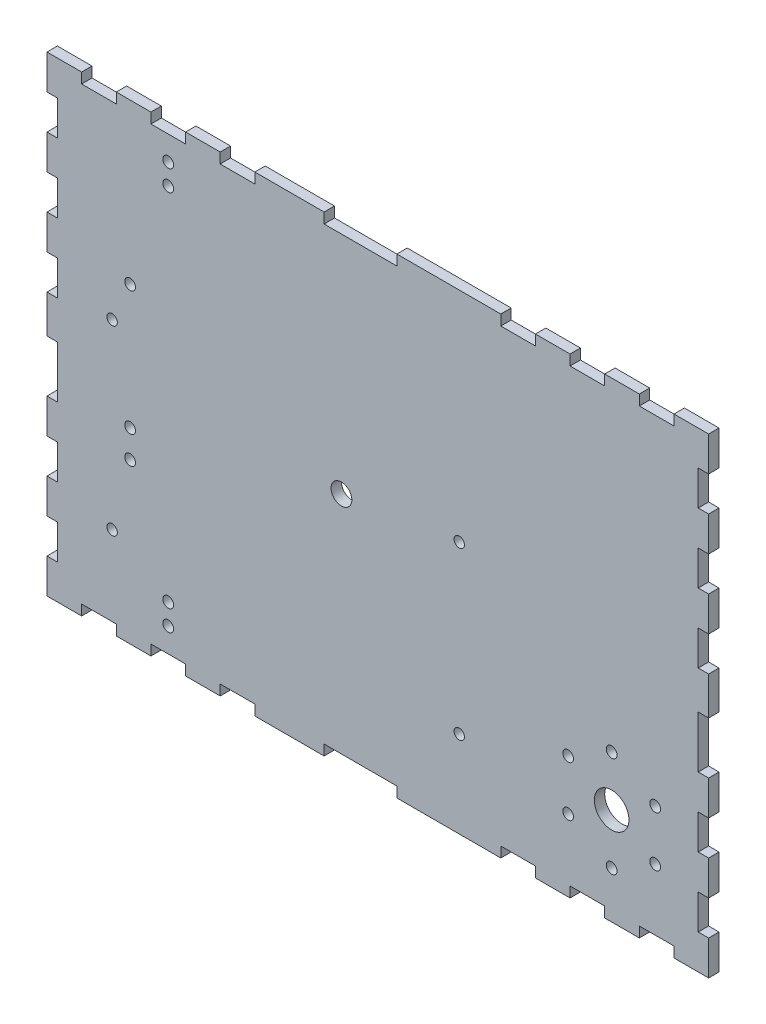
from build123d import *

# Parameters (mm, degrees)
SKETCH2_W           = 191
SKETCH2_H           = 136
SKETCH2_R           = 1.55
SKETCH2_R_2         = 1.549999948
SKETCH2_R_3         = 1.5
BOSS_EXTRUDE1_DEPTH = 3
CUT_EXTRUDE1_REACH  = 236.491
SKETCH3_W           = 10
SKETCH3_H           = 3
SKETCH3_W_2         = 21
CUT_EXTRUDE2_REACH  = 236.491
SKETCH4_W           = 3
SKETCH4_H           = 10
SKETCH4_H_2         = 15
CUT_EXTRUDE3_REACH  = 236.491
SKETCH8_R           = 5
CUT_EXTRUDE4_REACH  = 236.491
SKETCH9_R           = 3


with BuildPart() as part:
    # Sketch2 → Boss-Extrude1 (new body)
    with BuildSketch(Plane.XY):
        with Locations((95.5, 68)):
            Rectangle(SKETCH2_W, SKETCH2_H)
        with Locations((35, 16)):
            Circle(SKETCH2_R, mode=Mode.SUBTRACT)
        with Locations((35, 10)):
            Circle(SKETCH2_R, mode=Mode.SUBTRACT)
        with Locations((24, 46.069195574)):
            Circle(SKETCH2_R, mode=Mode.SUBTRACT)
        with Locations((24, 54.069195574)):
            Circle(SKETCH2_R, mode=Mode.SUBTRACT)
        with Locations((24, 89.930804426)):
            Circle(SKETCH2_R, mode=Mode.SUBTRACT)
        with Locations((35, 120)):
            Circle(SKETCH2_R, mode=Mode.SUBTRACT)
        with Locations((35, 126)):
            Circle(SKETCH2_R, mode=Mode.SUBTRACT)
        with Locations((175.557368355, 35.25)):
            Circle(SKETCH2_R_2, mode=Mode.SUBTRACT)
        with Locations((163, 42.5)):
            Circle(SKETCH2_R_2, mode=Mode.SUBTRACT)
        with Locations((150.442631645, 35.25)):
            Circle(SKETCH2_R_2, mode=Mode.SUBTRACT)
        with Locations((150.442631645, 20.75)):
            Circle(SKETCH2_R_2, mode=Mode.SUBTRACT)
        with Locations((163, 13.5)):
            Circle(SKETCH2_R_2, mode=Mode.SUBTRACT)
        with Locations((175.557368355, 20.75)):
            Circle(SKETCH2_R_2, mode=Mode.SUBTRACT)
        with Locations((18.8, 78.5)):
            Circle(SKETCH2_R_3, mode=Mode.SUBTRACT)
        with Locations((18.8, 26)):
            Circle(SKETCH2_R_3, mode=Mode.SUBTRACT)
        with Locations((119, 73)):
            Circle(SKETCH2_R_3, mode=Mode.SUBTRACT)
        with Locations((119, 25)):
            Circle(SKETCH2_R_3, mode=Mode.SUBTRACT)
    extrude(amount=BOSS_EXTRUDE1_DEPTH)

    # Sketch3 → Cut-Extrude1 (cut, up to next)
    with BuildSketch(Plane.XY.offset(3), mode=Mode.PRIVATE) as cut_extrude1_sk1:
        with Locations((176, 1.5)):
            Rectangle(SKETCH3_W, SKETCH3_H)
    cut_extrude1_tool1 = extrude(cut_extrude1_sk1.sketch, amount=-CUT_EXTRUDE1_REACH, mode=Mode.PRIVATE) & part.part
    # Sketch3 → Cut-Extrude1 (cut, up to next)
    with BuildSketch(Plane.XY.offset(3), mode=Mode.PRIVATE) as cut_extrude1_sk2:
        with Locations((156, 1.5)):
            Rectangle(SKETCH3_W, SKETCH3_H)
    cut_extrude1_tool2 = extrude(cut_extrude1_sk2.sketch, amount=-CUT_EXTRUDE1_REACH, mode=Mode.PRIVATE) & part.part
    # Sketch3 → Cut-Extrude1 (cut, up to next)
    with BuildSketch(Plane.XY.offset(3), mode=Mode.PRIVATE) as cut_extrude1_sk3:
        with Locations((136, 1.5)):
            Rectangle(SKETCH3_W, SKETCH3_H)
    cut_extrude1_tool3 = extrude(cut_extrude1_sk3.sketch, amount=-CUT_EXTRUDE1_REACH, mode=Mode.PRIVATE) & part.part
    # Sketch3 → Cut-Extrude1 (cut, up to next)
    with BuildSketch(Plane.XY.offset(3), mode=Mode.PRIVATE) as cut_extrude1_sk4:
        with Locations((90.5, 1.5)):
            Rectangle(SKETCH3_W_2, SKETCH3_H)
    cut_extrude1_tool4 = extrude(cut_extrude1_sk4.sketch, amount=-CUT_EXTRUDE1_REACH, mode=Mode.PRIVATE) & part.part
    # Sketch3 → Cut-Extrude1 (cut, up to next)
    with BuildSketch(Plane.XY.offset(3), mode=Mode.PRIVATE) as cut_extrude1_sk5:
        with Locations((55, 1.5)):
            Rectangle(SKETCH3_W, SKETCH3_H)
    cut_extrude1_tool5 = extrude(cut_extrude1_sk5.sketch, amount=-CUT_EXTRUDE1_REACH, mode=Mode.PRIVATE) & part.part
    # Sketch3 → Cut-Extrude1 (cut, up to next)
    with BuildSketch(Plane.XY.offset(3), mode=Mode.PRIVATE) as cut_extrude1_sk6:
        with Locations((35, 1.5)):
            Rectangle(SKETCH3_W, SKETCH3_H)
    cut_extrude1_tool6 = extrude(cut_extrude1_sk6.sketch, amount=-CUT_EXTRUDE1_REACH, mode=Mode.PRIVATE) & part.part
    # Sketch3 → Cut-Extrude1 (cut, up to next)
    with BuildSketch(Plane.XY.offset(3), mode=Mode.PRIVATE) as cut_extrude1_sk7:
        with Locations((15, 1.5)):
            Rectangle(SKETCH3_W, SKETCH3_H)
    cut_extrude1_tool7 = extrude(cut_extrude1_sk7.sketch, amount=-CUT_EXTRUDE1_REACH, mode=Mode.PRIVATE) & part.part
    cut_extrude1_1 = cut_extrude1_tool1.solids().sort_by_distance((176, 1.5, 3))[0]
    add(cut_extrude1_1, mode=Mode.SUBTRACT)
    cut_extrude1_2 = cut_extrude1_tool2.solids().sort_by_distance((156, 1.5, 3))[0]
    add(cut_extrude1_2, mode=Mode.SUBTRACT)
    cut_extrude1_3 = cut_extrude1_tool3.solids().sort_by_distance((136, 1.5, 3))[0]
    add(cut_extrude1_3, mode=Mode.SUBTRACT)
    cut_extrude1_4 = cut_extrude1_tool4.solids().sort_by_distance((90.5, 1.5, 3))[0]
    add(cut_extrude1_4, mode=Mode.SUBTRACT)
    cut_extrude1_5 = cut_extrude1_tool5.solids().sort_by_distance((55, 1.5, 3))[0]
    add(cut_extrude1_5, mode=Mode.SUBTRACT)
    cut_extrude1_6 = cut_extrude1_tool6.solids().sort_by_distance((35, 1.5, 3))[0]
    add(cut_extrude1_6, mode=Mode.SUBTRACT)
    cut_extrude1_7 = cut_extrude1_tool7.solids().sort_by_distance((15, 1.5, 3))[0]
    add(cut_extrude1_7, mode=Mode.SUBTRACT)
    cut_extrude1 = cut_extrude1_1 + cut_extrude1_2 + cut_extrude1_3 + cut_extrude1_4 + cut_extrude1_5 + cut_extrude1_6 + cut_extrude1_7  # Cut-Extrude1 as one shape, for the pattern or mirror that repeats it

    # Mirror1: Cut-Extrude1 across plane
    add(cut_extrude1.mirror(Plane.ZX.offset(68)), mode=Mode.SUBTRACT)

    # Sketch4 → Cut-Extrude2 (cut, up to next)
    with BuildSketch(Plane.XY.offset(3), mode=Mode.PRIVATE) as cut_extrude2_sk1:
        with Locations((1.5, 121)):
            Rectangle(SKETCH4_W, SKETCH4_H)
    cut_extrude2_tool1 = extrude(cut_extrude2_sk1.sketch, amount=-CUT_EXTRUDE2_REACH, mode=Mode.PRIVATE) & part.part
    # Sketch4 → Cut-Extrude2 (cut, up to next)
    with BuildSketch(Plane.XY.offset(3), mode=Mode.PRIVATE) as cut_extrude2_sk2:
        with Locations((1.5, 101)):
            Rectangle(SKETCH4_W, SKETCH4_H)
    cut_extrude2_tool2 = extrude(cut_extrude2_sk2.sketch, amount=-CUT_EXTRUDE2_REACH, mode=Mode.PRIVATE) & part.part
    # Sketch4 → Cut-Extrude2 (cut, up to next)
    with BuildSketch(Plane.XY.offset(3), mode=Mode.PRIVATE) as cut_extrude2_sk3:
        with Locations((1.5, 81)):
            Rectangle(SKETCH4_W, SKETCH4_H)
    cut_extrude2_tool3 = extrude(cut_extrude2_sk3.sketch, amount=-CUT_EXTRUDE2_REACH, mode=Mode.PRIVATE) & part.part
    # Sketch4 → Cut-Extrude2 (cut, up to next)
    with BuildSketch(Plane.XY.offset(3), mode=Mode.PRIVATE) as cut_extrude2_sk4:
        with Locations((1.5, 15)):
            Rectangle(SKETCH4_W, SKETCH4_H)
    cut_extrude2_tool4 = extrude(cut_extrude2_sk4.sketch, amount=-CUT_EXTRUDE2_REACH, mode=Mode.PRIVATE) & part.part
    # Sketch4 → Cut-Extrude2 (cut, up to next)
    with BuildSketch(Plane.XY.offset(3), mode=Mode.PRIVATE) as cut_extrude2_sk5:
        with Locations((1.5, 35)):
            Rectangle(SKETCH4_W, SKETCH4_H)
    cut_extrude2_tool5 = extrude(cut_extrude2_sk5.sketch, amount=-CUT_EXTRUDE2_REACH, mode=Mode.PRIVATE) & part.part
    # Sketch4 → Cut-Extrude2 (cut, up to next)
    with BuildSketch(Plane.XY.offset(3), mode=Mode.PRIVATE) as cut_extrude2_sk6:
        with Locations((1.5, 57.5)):
            Rectangle(SKETCH4_W, SKETCH4_H_2)
    cut_extrude2_tool6 = extrude(cut_extrude2_sk6.sketch, amount=-CUT_EXTRUDE2_REACH, mode=Mode.PRIVATE) & part.part
    cut_extrude2_1 = cut_extrude2_tool1.solids().sort_by_distance((1.5, 121, 3))[0]
    add(cut_extrude2_1, mode=Mode.SUBTRACT)
    cut_extrude2_2 = cut_extrude2_tool2.solids().sort_by_distance((1.5, 101, 3))[0]
    add(cut_extrude2_2, mode=Mode.SUBTRACT)
    cut_extrude2_3 = cut_extrude2_tool3.solids().sort_by_distance((1.5, 81, 3))[0]
    add(cut_extrude2_3, mode=Mode.SUBTRACT)
    cut_extrude2_4 = cut_extrude2_tool4.solids().sort_by_distance((1.5, 15, 3))[0]
    add(cut_extrude2_4, mode=Mode.SUBTRACT)
    cut_extrude2_5 = cut_extrude2_tool5.solids().sort_by_distance((1.5, 35, 3))[0]
    add(cut_extrude2_5, mode=Mode.SUBTRACT)
    cut_extrude2_6 = cut_extrude2_tool6.solids().sort_by_distance((1.5, 57.5, 3))[0]
    add(cut_extrude2_6, mode=Mode.SUBTRACT)
    cut_extrude2 = cut_extrude2_1 + cut_extrude2_2 + cut_extrude2_3 + cut_extrude2_4 + cut_extrude2_5 + cut_extrude2_6  # Cut-Extrude2 as one shape, for the pattern or mirror that repeats it

    # Mirror2: Cut-Extrude2 across plane
    add(cut_extrude2.mirror(Plane(origin=(95.5, 0, 0), x_dir=(0, 0, 1), z_dir=(1, 0, 0))), mode=Mode.SUBTRACT)

    # Sketch8 → Cut-Extrude3 (cut, up to next)
    with BuildSketch(Plane(origin=(0, 0, 0), x_dir=(-1, 0, 0), z_dir=(0, 0, -1)), mode=Mode.PRIVATE) as cut_extrude3_sk1:
        with Locations((-163, 28)):
            Circle(SKETCH8_R)
    cut_extrude3_tool1 = extrude(cut_extrude3_sk1.sketch, amount=-CUT_EXTRUDE3_REACH, mode=Mode.PRIVATE) & part.part
    add(cut_extrude3_tool1.solids().sort_by_distance((163, 28, 0))[0], mode=Mode.SUBTRACT)

    # Sketch9 → Cut-Extrude4 (cut, up to next)
    with BuildSketch(Plane.XY.offset(3), mode=Mode.PRIVATE) as cut_extrude4_sk1:
        with Locations((85, 68)):
            Circle(SKETCH9_R)
    cut_extrude4_tool1 = extrude(cut_extrude4_sk1.sketch, amount=-CUT_EXTRUDE4_REACH, mode=Mode.PRIVATE) & part.part
    add(cut_extrude4_tool1.solids().sort_by_distance((85, 68, 3))[0], mode=Mode.SUBTRACT)


solid = part.part
